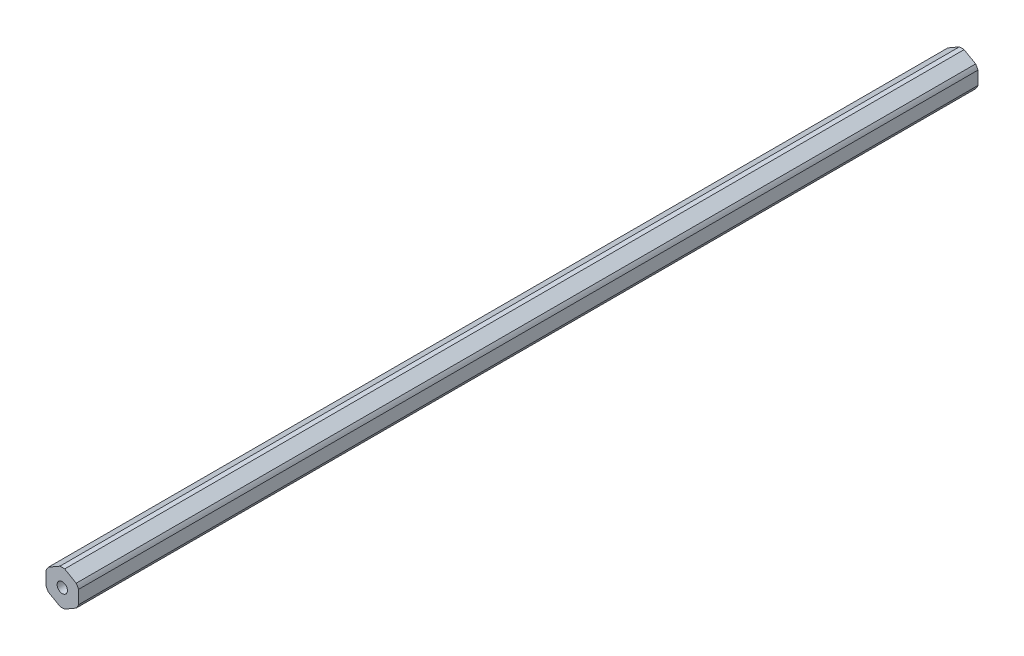
from build123d import *

# Parameters (mm, degrees)
BOSS_EXTRUDE1_DEPTH                  = 175.41875
F_10_32_TAPPED_HOLE1_D               = 4.0386
F_10_32_TAPPED_HOLE1_DEPTH           = 16.34744
F_10_32_TAPPED_HOLE1_TIP             = 1.213317848
F_10_32_TAPPED_HOLE1_ON_FACE_2_D     = 4.0386
F_10_32_TAPPED_HOLE1_ON_FACE_2_DEPTH = 16.34744
F_10_32_TAPPED_HOLE1_ON_FACE_2_TIP   = 1.213317848


with BuildPart() as part:
    # Sketch1 → Boss-Extrude1 (new, symmetric)
    with BuildSketch(Plane.XY):
        with BuildLine():
            ThreePointArc((0.93173274, 6.79441227), (0, 6.858), (-0.93173274, 6.79441227))
            Line((-0.93173274, 6.79441227), (-5.41826726, 4.204110358))
            ThreePointArc((-5.41826726, 4.204110358), (-5.939202219, 3.429), (-6.35, 2.590301913))
            Line((-6.35, 2.590301913), (-6.35, -2.590301913))
            ThreePointArc((-6.35, -2.590301913), (-5.939202219, -3.429), (-5.41826726, -4.204110358))
            Line((-5.41826726, -4.204110358), (-0.93173274, -6.79441227))
            ThreePointArc((-0.93173274, -6.79441227), (0, -6.858), (0.93173274, -6.79441227))
            Line((0.93173274, -6.79441227), (5.41826726, -4.204110358))
            ThreePointArc((5.41826726, -4.204110358), (5.939202219, -3.429), (6.35, -2.590301913))
            Line((6.35, -2.590301913), (6.35, 2.590301913))
            ThreePointArc((6.35, 2.590301913), (5.939202219, 3.429), (5.41826726, 4.204110358))
            Line((5.41826726, 4.204110358), (0.93173274, 6.79441227))
        make_face()
    extrude(amount=BOSS_EXTRUDE1_DEPTH, both=True)

    # #10-32 Tapped Hole1
    with Locations(Plane.XY.offset(175.41875)):
        with Locations((0, 0)):
            Hole(F_10_32_TAPPED_HOLE1_D / 2, depth=F_10_32_TAPPED_HOLE1_DEPTH)
            with Locations((0, 0, -(F_10_32_TAPPED_HOLE1_DEPTH + F_10_32_TAPPED_HOLE1_TIP / 2))):  # 118° drill point
                Cone(0, F_10_32_TAPPED_HOLE1_D / 2, F_10_32_TAPPED_HOLE1_TIP, mode=Mode.SUBTRACT)

    # #10-32 Tapped Hole1 on face 2
    with Locations(Plane(origin=(0, 0, -175.41875), x_dir=(-1, 0, 0), z_dir=(0, 0, -1))):
        with Locations((0, 0)):
            Hole(F_10_32_TAPPED_HOLE1_ON_FACE_2_D / 2, depth=F_10_32_TAPPED_HOLE1_ON_FACE_2_DEPTH)
            with Locations((0, 0, -(F_10_32_TAPPED_HOLE1_ON_FACE_2_DEPTH + F_10_32_TAPPED_HOLE1_ON_FACE_2_TIP / 2))):  # 118° drill point
                Cone(0, F_10_32_TAPPED_HOLE1_ON_FACE_2_D / 2, F_10_32_TAPPED_HOLE1_ON_FACE_2_TIP, mode=Mode.SUBTRACT)


solid = part.part
